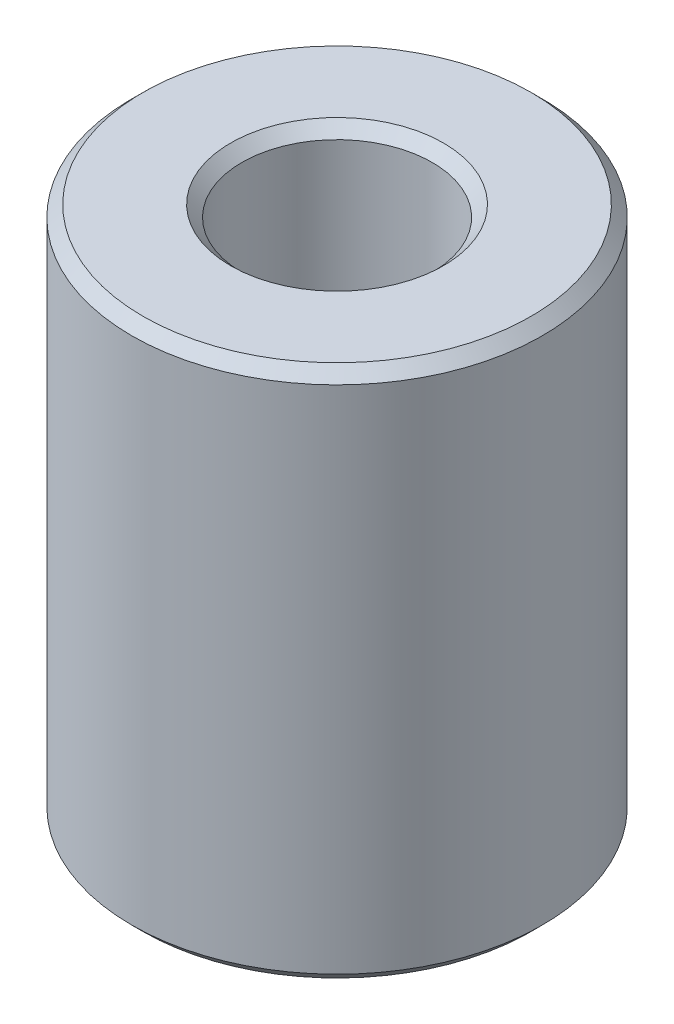
from build123d import *

# Parameters (mm, degrees)
SKETCH1_R           = 7.5
BOSS_EXTRUDE1_DEPTH = 19.472903196
SKETCH2_R           = 3.477940863
CUT_EXTRUDE1_DEPTH  = 23.17417324
CHAMFER1_SIZE       = 0.410540021


with BuildPart() as part:
    # Sketch1 → Boss-Extrude1 (new body)
    with BuildSketch(Plane(origin=(0, 0, 0), x_dir=(1, 0, 0), z_dir=(0, 1, 0))):
        Circle(SKETCH1_R)
    extrude(amount=BOSS_EXTRUDE1_DEPTH)

    # Sketch2 → Cut-Extrude1 (cut, through all)
    with BuildSketch(Plane(origin=(0, 0, 0), x_dir=(1, 0, 0), z_dir=(0, 1, 0))):
        Circle(SKETCH2_R)
    extrude(amount=CUT_EXTRUDE1_DEPTH, mode=Mode.SUBTRACT)

    # Chamfer1
    chamfer1_edges = [part.edges().sort_by_distance(p)[0] for p in [
        (-3.477940863, 19.472903196, 0),
        (-3.477940863, 0, 0),
        (-7.5, 0, 0),
        (-7.5, 19.472903196, 0),
    ]]
    chamfer(chamfer1_edges, length=CHAMFER1_SIZE)


solid = part.part
